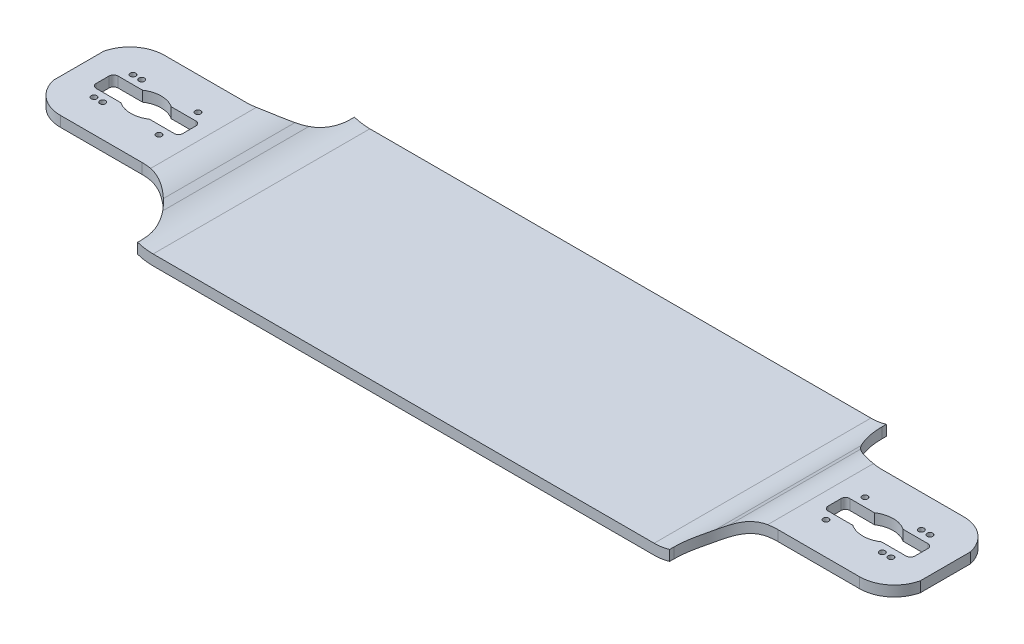
from build123d import *

# Parameters (mm, degrees)
BOSS_EXTRUDE2_DEPTH    = 300
CUT_EXTRUDE3_START     = -32
CUT_EXTRUDE3_OUTLINE_R = 3.25
CUT_EXTRUDE3_DEPTH     = 32


# Read off the part's stored shape, not the designer's step: Cut-Extrude3
with BuildPart() as part:
    # Sketch3 → Boss-Extrude2 (new body)
    with BuildSketch(Plane.XY):
        with BuildLine():
            Line((-288.970554703, 0), (288.970554703, 0))
            ThreePointArc((288.970554703, 0), (304.314545187, 1.995155754), (318.638080641, 7.847934799))
            Line((318.638080641, 7.847934799), (326.204242032, 12.152065201))
            ThreePointArc((326.204242032, 12.152065201), (340.527777486, 18.004844246), (355.871767971, 20))
            Line((355.871767971, 20), (500, 20))
            Line((500, 20), (500, 32))
            Line((500, 32), (355.871767971, 32))
            ThreePointArc((355.871767971, 32), (340.527777486, 30.004844246), (326.204242032, 24.152065201))
            Line((326.204242032, 24.152065201), (318.638080641, 19.847934799))
            ThreePointArc((318.638080641, 19.847934799), (304.314545187, 13.995155754), (288.970554703, 12))
            Line((288.970554703, 12), (-288.970554703, 12))
            ThreePointArc((-288.970554703, 12), (-304.314545187, 13.995155754), (-318.638080641, 19.847934799))
            Line((-318.638080641, 19.847934799), (-326.204242032, 24.152065201))
            ThreePointArc((-326.204242032, 24.152065201), (-340.527777486, 30.004844246), (-355.871767971, 32))
            Line((-355.871767971, 32), (-500, 32))
            Line((-500, 32), (-500, 20))
            Line((-500, 20), (-355.871767971, 20))
            ThreePointArc((-355.871767971, 20), (-340.527777486, 18.004844246), (-326.204242032, 12.152065201))
            Line((-326.204242032, 12.152065201), (-318.638080641, 7.847934799))
            ThreePointArc((-318.638080641, 7.847934799), (-304.314545187, 1.995155754), (-288.970554703, 0))
        make_face()
    extrude(amount=BOSS_EXTRUDE2_DEPTH)

    # Cut-Extrude3 outline → Cut-Extrude3 (cut)
    with BuildSketch(Plane(origin=(0, 32, 0), x_dir=(1, 0, 0), z_dir=(0, 1, 0)).offset(CUT_EXTRUDE3_START)):
        with BuildLine():
            ThreePointArc((500, -177.982767946), (485.92136521, -200.271413851), (461.031189607, -208.958810024))
            Line((461.031189607, -208.958810024), (366.841715774, -208.958810024))
            ThreePointArc((366.841715774, -208.958810024), (324.415308902, -226.532403152), (306.841715774, -268.958810024))
            Line((306.841715774, -268.958810024), (306.841715774, -273.963929443))
            Line((306.841715774, -273.963929443), (-306.841715774, -273.963929443))
            Line((-306.841715774, -273.963929443), (-306.841715774, -268.958810024))
            ThreePointArc((-306.841715774, -268.958810024), (-324.415308902, -226.532403152), (-366.841715774, -208.958810024))
            Line((-366.841715774, -208.958810024), (-461.031189607, -208.958810024))
            ThreePointArc((-461.031189607, -208.958810024), (-485.92136521, -200.271413851), (-500, -177.982767946))
            Line((-500, -177.982767946), (-500, -300))
            Line((-500, -300), (500, -300))
            Line((500, -300), (500, -177.982767946))
        make_face()
        with BuildLine():
            ThreePointArc((461.031189607, -88.958810024), (485.92136521, -97.646206196), (500, -119.934852101))
            Line((500, -119.934852101), (500, 0))
            Line((500, 0), (-500, 0))
            Line((-500, 0), (-500, -119.934852101))
            ThreePointArc((-500, -119.934852101), (-485.92136521, -97.646206196), (-461.031189607, -88.958810024))
            Line((-461.031189607, -88.958810024), (-366.841715774, -88.958810024))
            ThreePointArc((-366.841715774, -88.958810024), (-324.415308903, -71.385216896), (-306.841715774, -28.958810024))
            Line((-306.841715774, -28.958810024), (-306.841715774, -23.963929443))
            Line((-306.841715774, -23.963929443), (306.841715774, -23.963929443))
            Line((306.841715774, -23.963929443), (306.841715774, -28.958810024))
            ThreePointArc((306.841715774, -28.958810024), (324.415308902, -71.385216896), (366.841715774, -88.958810024))
            Line((366.841715774, -88.958810024), (461.031189607, -88.958810024))
        make_face()
        with BuildLine():
            Line((-438.732830391, -136.458810024), (-467.149706439, -136.458810024))
            ThreePointArc((-467.149706439, -136.458810024), (-470.685240345, -137.923276118), (-472.149706439, -141.458810024))
            Line((-472.149706439, -141.458810024), (-472.149706439, -156.458810024))
            ThreePointArc((-472.149706439, -156.458810024), (-470.685240345, -159.99434393), (-467.149706439, -161.458810024))
            Line((-467.149706439, -161.458810024), (-438.732830391, -161.458810024))
            ThreePointArc((-438.732830391, -161.458810024), (-422.149706439, -166.458810024), (-405.566582488, -161.458810024))
            Line((-405.566582488, -161.458810024), (-377.149706439, -161.458810024))
            ThreePointArc((-377.149706439, -161.458810024), (-373.614172533, -159.99434393), (-372.149706439, -156.458810024))
            Line((-372.149706439, -156.458810024), (-372.149706439, -141.458810024))
            ThreePointArc((-372.149706439, -141.458810024), (-373.614172533, -137.923276118), (-377.149706439, -136.458810024))
            Line((-377.149706439, -136.458810024), (-405.566582488, -136.458810024))
            ThreePointArc((-405.566582488, -136.458810024), (-422.149706439, -131.458810024), (-438.732830391, -136.458810024))
        make_face()
        with BuildLine():
            ThreePointArc((438.732830391, -136.458810024), (422.149706439, -131.458810024), (405.566582488, -136.458810024))
            Line((405.566582488, -136.458810024), (377.149706439, -136.458810024))
            ThreePointArc((377.149706439, -136.458810024), (373.614172533, -137.923276118), (372.149706439, -141.458810024))
            Line((372.149706439, -141.458810024), (372.149706439, -156.458810024))
            ThreePointArc((372.149706439, -156.458810024), (373.614172533, -159.99434393), (377.149706439, -161.458810024))
            Line((377.149706439, -161.458810024), (405.566582488, -161.458810024))
            ThreePointArc((405.566582488, -161.458810024), (422.149706439, -166.458810024), (438.732830391, -161.458810024))
            Line((438.732830391, -161.458810024), (467.149706439, -161.458810024))
            ThreePointArc((467.149706439, -161.458810024), (470.685240345, -159.99434393), (472.149706439, -156.458810024))
            Line((472.149706439, -156.458810024), (472.149706439, -141.458810024))
            ThreePointArc((472.149706439, -141.458810024), (470.685240345, -137.923276118), (467.149706439, -136.458810024))
            Line((467.149706439, -136.458810024), (438.732830391, -136.458810024))
        make_face()
        with Locations((-384.649706439, -171.458810024)):
            Circle(CUT_EXTRUDE3_OUTLINE_R)
        with Locations((-384.649706439, -126.458810024)):
            Circle(CUT_EXTRUDE3_OUTLINE_R)
        with Locations((-449.649706439, -171.458810024)):
            Circle(CUT_EXTRUDE3_OUTLINE_R)
        with Locations((-459.649706439, -171.458810024)):
            Circle(CUT_EXTRUDE3_OUTLINE_R)
        with Locations((-449.649706439, -126.458810024)):
            Circle(CUT_EXTRUDE3_OUTLINE_R)
        with Locations((-459.649706439, -126.458810024)):
            Circle(CUT_EXTRUDE3_OUTLINE_R)
        with Locations((459.649706439, -126.458810024)):
            Circle(CUT_EXTRUDE3_OUTLINE_R)
        with Locations((449.649706439, -126.458810024)):
            Circle(CUT_EXTRUDE3_OUTLINE_R)
        with Locations((384.649706439, -126.458810024)):
            Circle(CUT_EXTRUDE3_OUTLINE_R)
        with Locations((384.649706439, -171.458810024)):
            Circle(CUT_EXTRUDE3_OUTLINE_R)
        with Locations((449.649706439, -171.458810024)):
            Circle(CUT_EXTRUDE3_OUTLINE_R)
        with Locations((459.649706439, -171.458810024)):
            Circle(CUT_EXTRUDE3_OUTLINE_R)
    extrude(amount=CUT_EXTRUDE3_DEPTH, mode=Mode.SUBTRACT)


solid = part.part
